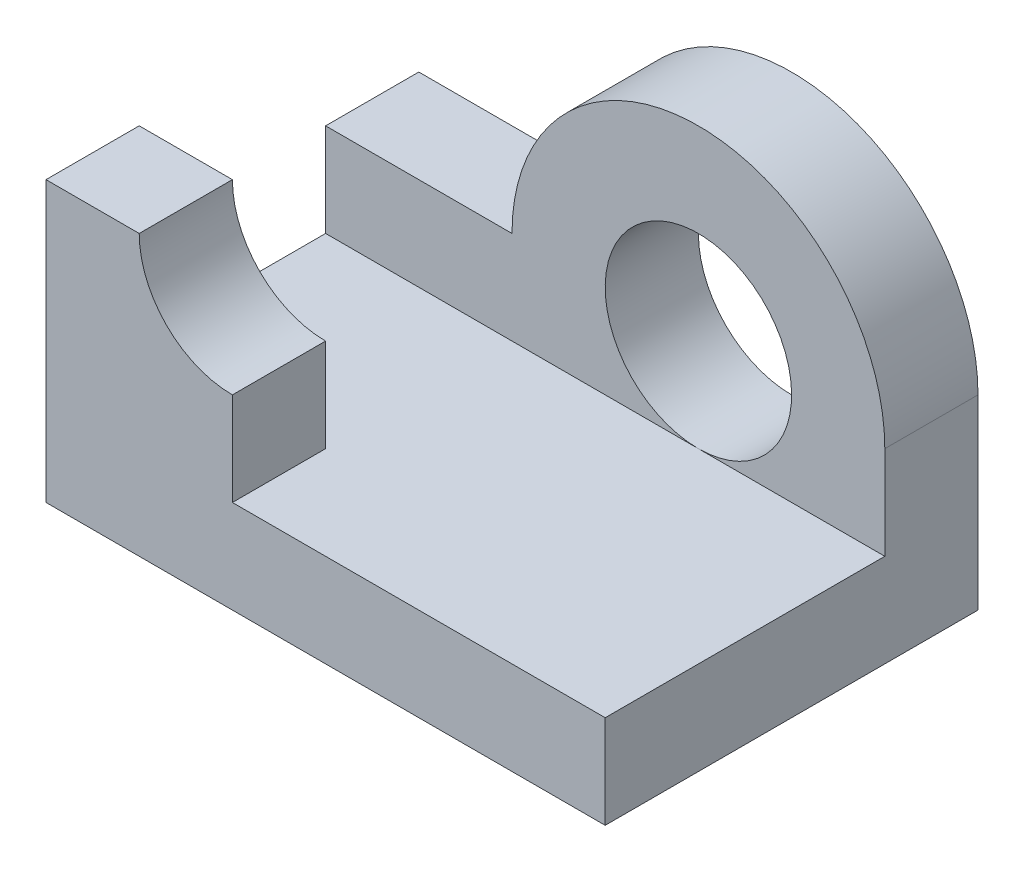
from build123d import *

# Parameters (mm, degrees)
SKETCH_1_R      = 5
EXTRUDE_1_DEPTH = 5
SKETCH_2_W      = 30
SKETCH_2_H      = 5
EXTRUDE_3_DEPTH = 15
EXTRUDE_4_DEPTH = 5
FILLET_1_R      = 5
SKETCH_4_W      = 5
SKETCH_4_H      = 5
EXTRUDE_5_DEPTH = 10


with BuildPart() as part:
    # 草圖1 → 填料-伸長1 (new body)
    with BuildSketch(Plane.XY):
        with BuildLine():
            Line((10, 0), (10, -10))
            Line((10, -10), (-20, -10))
            Line((-20, -10), (-20, -5))
            Line((-20, -5), (-10, -5))
            Line((-10, -5), (-10, 0))
            ThreePointArc((-10, 0), (0, 10), (10, 0))
        make_face()
        Circle(SKETCH_1_R, mode=Mode.SUBTRACT)
    extrude(amount=EXTRUDE_1_DEPTH)

    # 草圖2 → 填料-伸長3 (add)
    with BuildSketch(Plane.XY.offset(5)):
        with Locations((-5, -7.5)):
            Rectangle(SKETCH_2_W, SKETCH_2_H)
    extrude(amount=EXTRUDE_3_DEPTH)

    # 草圖3 → 填料-伸長4 (add)
    with BuildSketch(Plane.XY.offset(20)):
        Polygon((-20, -5), (-10, -5), (-10, 0), (-15, 0), (-15, 5), (-20, 5), align=None)
    extrude(amount=-EXTRUDE_4_DEPTH)

    # 圓角1
    fillet_1_edges = [part.edges().sort_by_distance(p)[0] for p in [
        (-15, 0, 17.5),
    ]]
    fillet(fillet_1_edges, radius=FILLET_1_R - 0.0001)  # a hair under: the kernel refuses the full size

    # 草圖4 → 填料-伸長5 (add)
    with BuildSketch(Plane.ZY.offset(10)):
        with Locations((2.5, -2.5)):
            Rectangle(SKETCH_4_W, SKETCH_4_H)
    extrude(amount=EXTRUDE_5_DEPTH)


solid = part.part
